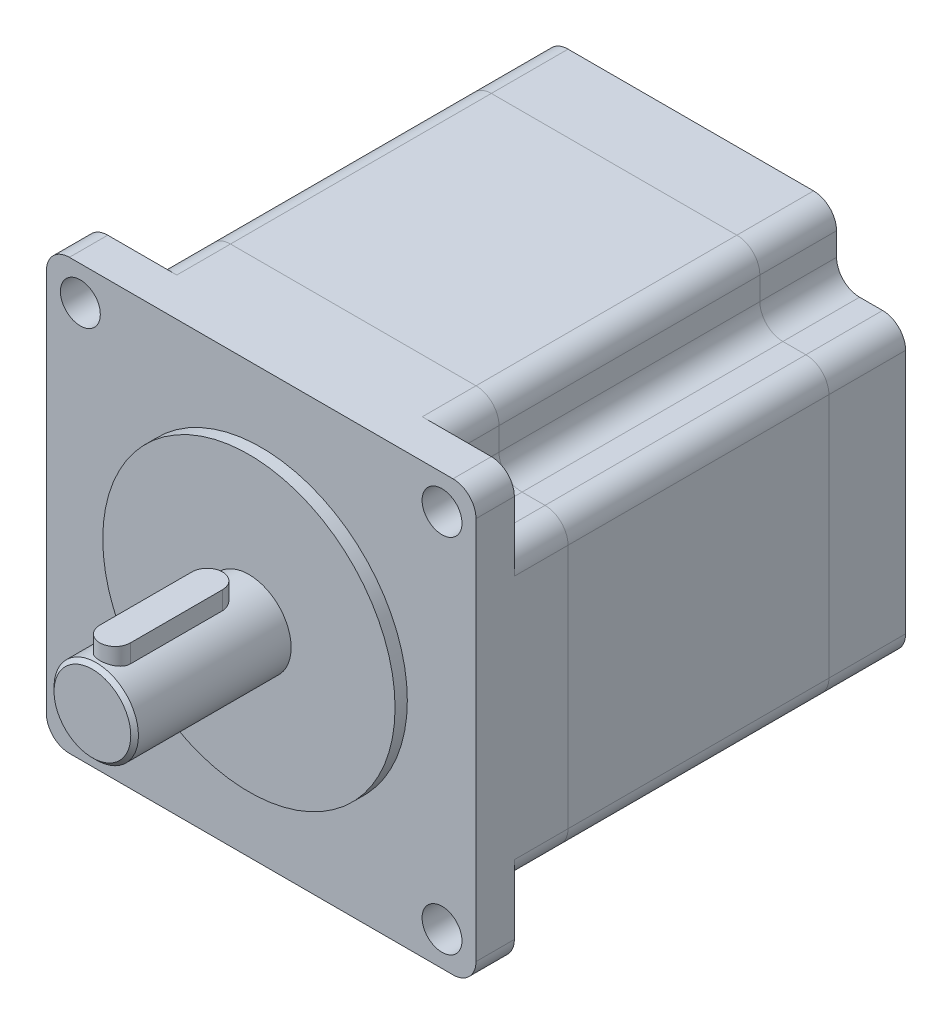
from build123d import *

# Parameters (mm, degrees)
SALIENTE_EXTRUIR1_DEPTH                      = 28
PERFORADOR_PARA_ROSCAR_HELICOIL_DE_M51_D     = 5.2
PERFORADOR_PARA_ROSCAR_HELICOIL_DE_M51_DEPTH = 9
PERFORADOR_PARA_ROSCAR_HELICOIL_DE_M51_TIP   = 1.562237609
CORTAR_EXTRUIR1_START                        = -51
CORTAR_EXTRUIR1_DEPTH                        = 51
SIMETR_A4_START                              = -51
SIMETR_A4_COPY_1_DEPTH                       = 51
SIMETR_A4_COPY_2_DEPTH                       = 51
REDONDEO1_R                                  = 3
CROQUIS6_R                                   = 19.05
SALIENTE_EXTRUIR2_DEPTH                      = 1.6
CROQUIS7_R                                   = 5.5
SALIENTE_EXTRUIR3_DEPTH                      = 20.4
CHAFL_N1_SIZE                                = 0.5
SALIENTE_EXTRUIR4_DEPTH                      = 2
SALIENTE_EXTRUIR4_DEPTH_BACK                 = 2
PARTIR1_START                                = -28
PARTIR1_DEPTH                                = 10
PARTIR1_2_DEPTH                              = 44
PARTIR1_START_2                              = -18
PARTIR1_3_DEPTH                              = 34


# Read off the part's stored shape, not the designer's step: Partir1
with BuildPart() as part:
    # Croquis1 → Saliente-Extruir1 (new, symmetric)
    with BuildSketch(Plane.XY):
        with BuildLine():
            Line((-25, 28), (25, 28))
            ThreePointArc((25, 28), (27.121320344, 27.121320344), (28, 25))
            Line((28, 25), (28, -25))
            ThreePointArc((28, -25), (27.121320344, -27.121320344), (25, -28))
            Line((25, -28), (-25, -28))
            ThreePointArc((-25, -28), (-27.121320344, -27.121320344), (-28, -25))
            Line((-28, -25), (-28, 25))
            ThreePointArc((-28, 25), (-27.121320344, 27.121320344), (-25, 28))
        make_face()
    extrude(amount=SALIENTE_EXTRUIR1_DEPTH, both=True)

    # Perforador para roscar Helicoil de M51
    with Locations(Plane(origin=(-23.57, 23.57, 28), x_dir=(1, 0, 0), z_dir=(0, 0, 1))):
        with Locations((0, 0), (47.14, 0), (47.14, -47.14), (0, -47.14)):
            Hole(PERFORADOR_PARA_ROSCAR_HELICOIL_DE_M51_D / 2, depth=PERFORADOR_PARA_ROSCAR_HELICOIL_DE_M51_DEPTH)
            with Locations((0, 0, -(PERFORADOR_PARA_ROSCAR_HELICOIL_DE_M51_DEPTH + PERFORADOR_PARA_ROSCAR_HELICOIL_DE_M51_TIP / 2))):  # 118° drill point
                Cone(0, PERFORADOR_PARA_ROSCAR_HELICOIL_DE_M51_D / 2, PERFORADOR_PARA_ROSCAR_HELICOIL_DE_M51_TIP, mode=Mode.SUBTRACT)

    # Croquis5 → Cortar-Extruir1 (cut)
    with BuildSketch(Plane(origin=(0, 0, -28), x_dir=(-1, 0, 0), z_dir=(0, 0, -1)).offset(CORTAR_EXTRUIR1_START)):
        with BuildLine():
            Line((-28, 25), (-28, 19))
            Line((-28, 19), (-19, 19))
            Line((-19, 19), (-19, 28))
            Line((-19, 28), (-25, 28))
            ThreePointArc((-25, 28), (-27.121320344, 27.121320344), (-28, 25))
        make_face()
    cortar_extruir1 = extrude(amount=CORTAR_EXTRUIR1_DEPTH, mode=Mode.SUBTRACT)

    # Simetría1: Cortar-Extruir1 across plane
    add(cortar_extruir1.mirror(Plane(origin=(0, 0, 0), x_dir=(0, 0, 1), z_dir=(1, 0, 0))), mode=Mode.SUBTRACT)

    # Simetría3: Cortar-Extruir1 across plane
    add(cortar_extruir1.mirror(Plane.ZX), mode=Mode.SUBTRACT)

    # Simetría4 copy 1 sketch → Simetría4 copy 1 (cut)
    with BuildSketch(Plane(origin=(0, 0, -28), x_dir=(1, 0, 0), z_dir=(0, 0, -1)).offset(SIMETR_A4_START)):
        with BuildLine():
            Line((-28, 25), (-28, 19))
            Line((-28, 19), (-19, 19))
            Line((-19, 19), (-19, 28))
            Line((-19, 28), (-25, 28))
            ThreePointArc((-25, 28), (-27.121320344, 27.121320344), (-28, 25))
        make_face()
    extrude(amount=SIMETR_A4_COPY_1_DEPTH, mode=Mode.SUBTRACT)

    # Simetría4 copy 2 sketch → Simetría4 copy 2 (cut)
    with BuildSketch(Plane(origin=(0, 0, -28), x_dir=(1, 0, 0), z_dir=(0, 0, -1)).offset(SIMETR_A4_START)):
        with BuildLine():
            Line((-28, -25), (-28, -19))
            Line((-28, -19), (-19, -19))
            Line((-19, -19), (-19, -28))
            Line((-19, -28), (-25, -28))
            ThreePointArc((-25, -28), (-27.121320344, -27.121320344), (-28, -25))
        make_face()
    extrude(amount=SIMETR_A4_COPY_2_DEPTH, mode=Mode.SUBTRACT)

    # Redondeo1
    redondeo1_edges = [part.edges().sort_by_distance(p)[0] for p in [
        (-19, -19, -2.5),
        (-28, -19, -2.5),
        (-19, -28, -2.5),
        (19, 19, -2.5),
        (28, 19, -2.5),
        (19, 28, -2.5),
        (-28, 19, -2.5),
        (-19, 19, -2.5),
        (-19, 28, -2.5),
        (28, -19, -2.5),
        (19, -19, -2.5),
        (19, -28, -2.5),
    ]]
    fillet(redondeo1_edges, radius=REDONDEO1_R)

    # Croquis6 → Saliente-Extruir2 (add)
    with BuildSketch(Plane.XY.offset(28)):
        with Locations(Location((0, 0, 0), (0, 0, 180))):
            Circle(CROQUIS6_R)
    extrude(amount=SALIENTE_EXTRUIR2_DEPTH)

    # Croquis7 → Saliente-Extruir3 (add)
    with BuildSketch(Plane.XY.offset(29.6)):
        Circle(CROQUIS7_R)
    extrude(amount=SALIENTE_EXTRUIR3_DEPTH)

    # Chaflán1
    chafl_n1_edges = [part.edges().sort_by_distance(p)[0] for p in [
        (-5.5, 0, 50),
    ]]
    chamfer(chafl_n1_edges, length=CHAFL_N1_SIZE)

    # Croquis8 → Saliente-Extruir4 (add, two sides: drawn at the far end of the back side and taken through both)
    with BuildSketch(Plane(origin=(0, 5.5, 0), x_dir=(1, 0, 0), z_dir=(0, 1, 0)).offset(-SALIENTE_EXTRUIR4_DEPTH_BACK)):
        with BuildLine():
            Line((-2, -47.034811322), (-2, -35.034811322))
            ThreePointArc((-2, -35.034811322), (0, -33.034811322), (2, -35.034811322))
            Line((2, -35.034811322), (2, -47.034811322))
            ThreePointArc((2, -47.034811322), (0, -49.034811322), (-2, -47.034811322))
        make_face()
    extrude(amount=SALIENTE_EXTRUIR4_DEPTH + SALIENTE_EXTRUIR4_DEPTH_BACK)

    # Partir1 2 outline → Partir1 2 (cut)
    with BuildSketch(Plane.XY.offset(PARTIR1_START)):
        with BuildLine():
            Line((-16, -28), (16, -28))
            ThreePointArc((16, -28), (18.121320344, -27.121320344), (19, -25))
            Line((19, -25), (19, -22))
            ThreePointArc((19, -22), (19.878679656, -19.878679656), (22, -19))
            Line((22, -19), (25, -19))
            ThreePointArc((25, -19), (27.121320344, -18.121320344), (28, -16))
            Line((28, -16), (28, 16))
            ThreePointArc((28, 16), (27.121320344, 18.121320344), (25, 19))
            Line((25, 19), (22, 19))
            ThreePointArc((22, 19), (19.878679656, 19.878679656), (19, 22))
            Line((19, 22), (19, 25))
            ThreePointArc((19, 25), (18.121320344, 27.121320344), (16, 28))
            Line((16, 28), (-16, 28))
            ThreePointArc((-16, 28), (-18.121320344, 27.121320344), (-19, 25))
            Line((-19, 25), (-19, 22))
            ThreePointArc((-19, 22), (-19.878679656, 19.878679656), (-22, 19))
            Line((-22, 19), (-25, 19))
            ThreePointArc((-25, 19), (-27.121320344, 18.121320344), (-28, 16))
            Line((-28, 16), (-28, -16))
            ThreePointArc((-28, -16), (-27.121320344, -18.121320344), (-25, -19))
            Line((-25, -19), (-22, -19))
            ThreePointArc((-22, -19), (-19.878679656, -19.878679656), (-19, -22))
            Line((-19, -22), (-19, -25))
            ThreePointArc((-19, -25), (-18.121320344, -27.121320344), (-16, -28))
        make_face()
    extrude(amount=PARTIR1_2_DEPTH, mode=Mode.SUBTRACT)


with BuildPart() as body_2:
    # Partir1 outline → Partir1 (new body)
    with BuildSketch(Plane.XY.offset(PARTIR1_START)):
        with BuildLine():
            Line((-19, -22), (-19, -25))
            ThreePointArc((-19, -25), (-18.121320344, -27.121320344), (-16, -28))
            Line((-16, -28), (16, -28))
            ThreePointArc((16, -28), (18.121320344, -27.121320344), (19, -25))
            Line((19, -25), (19, -22))
            ThreePointArc((19, -22), (19.878679656, -19.878679656), (22, -19))
            Line((22, -19), (25, -19))
            ThreePointArc((25, -19), (27.121320344, -18.121320344), (28, -16))
            Line((28, -16), (28, 16))
            ThreePointArc((28, 16), (27.121320344, 18.121320344), (25, 19))
            Line((25, 19), (22, 19))
            ThreePointArc((22, 19), (19.878679656, 19.878679656), (19, 22))
            Line((19, 22), (19, 25))
            ThreePointArc((19, 25), (18.121320344, 27.121320344), (16, 28))
            Line((16, 28), (-16, 28))
            ThreePointArc((-16, 28), (-18.121320344, 27.121320344), (-19, 25))
            Line((-19, 25), (-19, 22))
            ThreePointArc((-19, 22), (-19.878679656, 19.878679656), (-22, 19))
            Line((-22, 19), (-25, 19))
            ThreePointArc((-25, 19), (-27.121320344, 18.121320344), (-28, 16))
            Line((-28, 16), (-28, -16))
            ThreePointArc((-28, -16), (-27.121320344, -18.121320344), (-25, -19))
            Line((-25, -19), (-22, -19))
            ThreePointArc((-22, -19), (-19.878679656, -19.878679656), (-19, -22))
        make_face()
    extrude(amount=PARTIR1_DEPTH)


with BuildPart() as body_3:
    # Partir1 3 outline → Partir1 3 (new body)
    with BuildSketch(Plane.XY.offset(PARTIR1_START_2)):
        with BuildLine():
            Line((-19, -22), (-19, -25))
            ThreePointArc((-19, -25), (-18.121320344, -27.121320344), (-16, -28))
            Line((-16, -28), (16, -28))
            ThreePointArc((16, -28), (18.121320344, -27.121320344), (19, -25))
            Line((19, -25), (19, -22))
            ThreePointArc((19, -22), (19.878679656, -19.878679656), (22, -19))
            Line((22, -19), (25, -19))
            ThreePointArc((25, -19), (27.121320344, -18.121320344), (28, -16))
            Line((28, -16), (28, 16))
            ThreePointArc((28, 16), (27.121320344, 18.121320344), (25, 19))
            Line((25, 19), (22, 19))
            ThreePointArc((22, 19), (19.878679656, 19.878679656), (19, 22))
            Line((19, 22), (19, 25))
            ThreePointArc((19, 25), (18.121320344, 27.121320344), (16, 28))
            Line((16, 28), (-16, 28))
            ThreePointArc((-16, 28), (-18.121320344, 27.121320344), (-19, 25))
            Line((-19, 25), (-19, 22))
            ThreePointArc((-19, 22), (-19.878679656, 19.878679656), (-22, 19))
            Line((-22, 19), (-25, 19))
            ThreePointArc((-25, 19), (-27.121320344, 18.121320344), (-28, 16))
            Line((-28, 16), (-28, -16))
            ThreePointArc((-28, -16), (-27.121320344, -18.121320344), (-25, -19))
            Line((-25, -19), (-22, -19))
            ThreePointArc((-22, -19), (-19.878679656, -19.878679656), (-19, -22))
        make_face()
    extrude(amount=PARTIR1_3_DEPTH)


solid = Compound([part.part, body_2.part, body_3.part])
